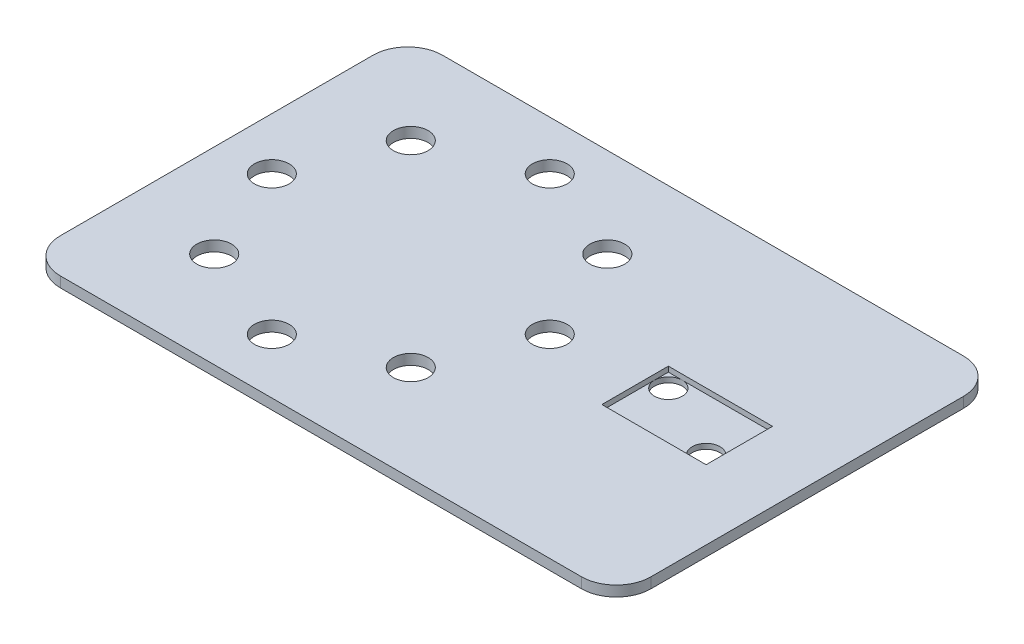
from build123d import *

# Parameters (mm, degrees)
SKETCH1_W           = 85
SKETCH1_H           = 55
SKETCH1_R           = 2.5
SKETCH1_W_2         = 15
SKETCH1_H_2         = 9.566733068
BOSS_EXTRUDE3_DEPTH = 1.5
FILLET2_R           = 5
BOSS_EXTRUDE4_REACH = 68.201
SKETCH2_W           = 9.566733068
SKETCH2_H           = 0.75
SKETCH3_R           = 2
CUT_EXTRUDE1_DEPTH  = 10


with BuildPart() as part:
    # Sketch1 → Boss-Extrude3 (new body)
    with BuildSketch(Plane(origin=(0, 0, 0), x_dir=(1, 0, 0), z_dir=(0, 1, 0))):
        with Locations((0, -0.433266932)):
            Rectangle(SKETCH1_W, SKETCH1_H)
        with Locations((-35, 0)):
            Circle(SKETCH1_R, mode=Mode.SUBTRACT)
        with Locations((-29.142135624, 14.142135624)):
            Circle(SKETCH1_R, mode=Mode.SUBTRACT)
        with Locations((-15, 20)):
            Circle(SKETCH1_R, mode=Mode.SUBTRACT)
        with Locations((-0.857864376, 14.142135624)):
            Circle(SKETCH1_R, mode=Mode.SUBTRACT)
        with Locations((5, 0)):
            Circle(SKETCH1_R, mode=Mode.SUBTRACT)
        with Locations((-0.857864376, -14.142135624)):
            Circle(SKETCH1_R, mode=Mode.SUBTRACT)
        with Locations((-15, -20)):
            Circle(SKETCH1_R, mode=Mode.SUBTRACT)
        with Locations((-29.142135624, -14.142135624)):
            Circle(SKETCH1_R, mode=Mode.SUBTRACT)
        with Locations((25, -0.216633466)):
            Rectangle(SKETCH1_W_2, SKETCH1_H_2, mode=Mode.SUBTRACT)
    extrude(amount=BOSS_EXTRUDE3_DEPTH)

    # Fillet2
    fillet2_edges = [part.edges().sort_by_distance(p)[0] for p in [
        (42.5, 0.75, -27.066733068),
        (-42.5, 0.75, -27.066733068),
        (-42.5, 0.75, 27.933266932),
        (42.5, 0.75, 27.933266932),
    ]]
    fillet(fillet2_edges, radius=FILLET2_R)

    # Sketch2 → Boss-Extrude4 (add, up to next)
    with BuildSketch(Plane(origin=(17.5, 0, 0), x_dir=(0, 0, -1), z_dir=(1, 0, 0)), mode=Mode.PRIVATE) as boss_extrude4_sk1:
        with Locations((-0.216633466, 0.375)):
            Rectangle(SKETCH2_W, SKETCH2_H)
    boss_extrude4_tool1 = extrude(boss_extrude4_sk1.sketch, amount=BOSS_EXTRUDE4_REACH, mode=Mode.PRIVATE) - part.part
    add(boss_extrude4_tool1.solids().sort_by_distance((17.5, 0.375, 0.216633))[0])

    # Sketch3 → Cut-Extrude1 (cut)
    with BuildSketch(Plane(origin=(0, 0.75, 0), x_dir=(1, 0, 0), z_dir=(0, 1, 0))):
        with Locations((19.5, 2.566733068)):
            Circle(SKETCH3_R)
        with Locations((30.5, -3)):
            Circle(SKETCH3_R)
    extrude(amount=-CUT_EXTRUDE1_DEPTH, mode=Mode.SUBTRACT)


solid = part.part
